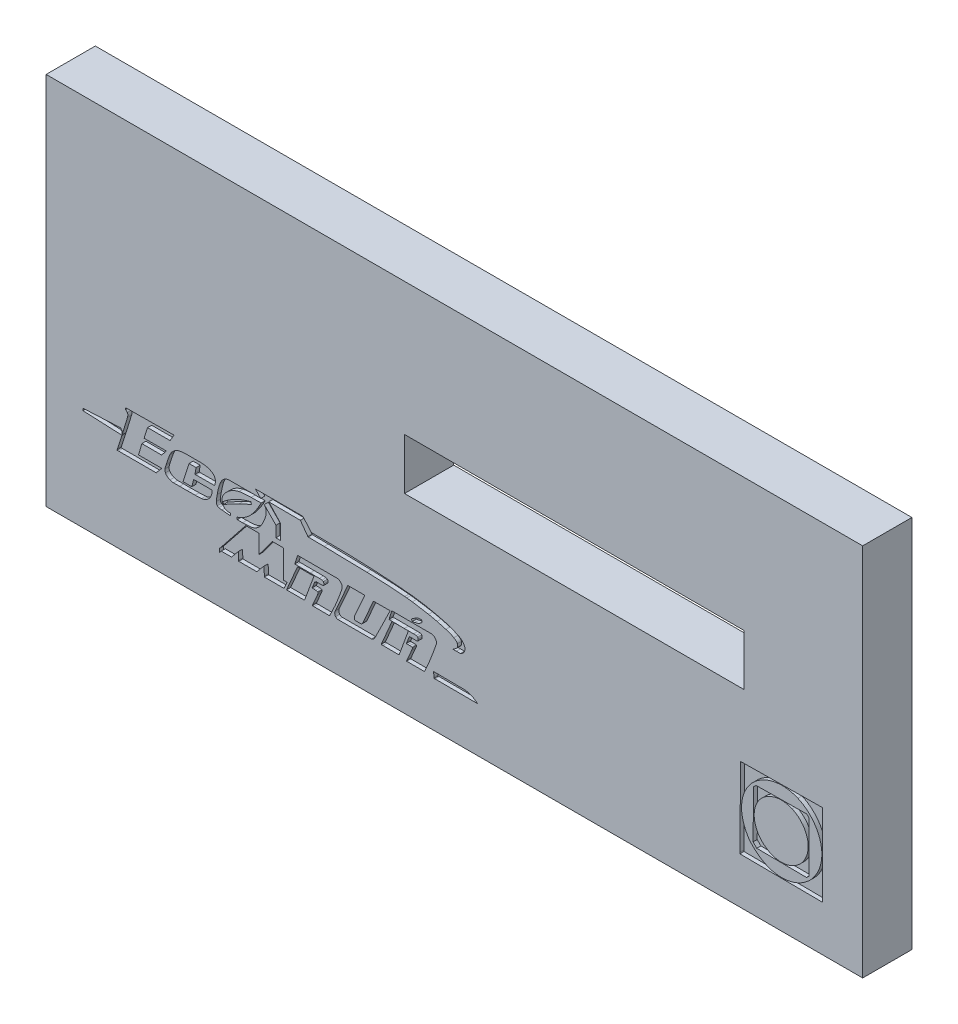
from build123d import *

# Parameters (mm, degrees)
SKETCH2_W                 = 99.573319
SKETCH2_H                 = 45.636873
SKETCH2_W_2               = 41.397503
SKETCH2_H_2               = 6.238481
BOSS_EXTRUDE1_DEPTH       = 5.5
BOSS_EXTRUDE2_START       = 5.5
BOSS_EXTRUDE2_OUTLINE_W   = 99.573319
BOSS_EXTRUDE2_OUTLINE_H   = 45.636873
BOSS_EXTRUDE2_OUTLINE_W_2 = 41.397503
BOSS_EXTRUDE2_OUTLINE_H_2 = 6.238481
BOSS_EXTRUDE2_DEPTH       = 0.5


# Read off the part's stored shape, not the designer's step: Boss-Extrude2
with BuildPart() as part:
    # Sketch2 → Boss-Extrude1 (new body)
    with BuildSketch(Plane.XY):
        with Locations((49.7865755, 22.8181985)):
            Rectangle(SKETCH2_W, SKETCH2_H)
        with Locations((64.4038695, 26.3477085)):
            Rectangle(SKETCH2_W_2, SKETCH2_H_2, mode=Mode.SUBTRACT)
    extrude(amount=BOSS_EXTRUDE1_DEPTH)

    # Boss-Extrude2 outline → Boss-Extrude2 (add)
    # profile 1 of 3: a face of its own
    with BuildSketch(Plane.XY.offset(BOSS_EXTRUDE2_START)):
        with Locations((49.7865755, 22.8181985)):
            Rectangle(BOSS_EXTRUDE2_OUTLINE_W, BOSS_EXTRUDE2_OUTLINE_H)
        with BuildLine():
            add(Edge.make_bspline(
                [(29.056566, 5.943609), (29.137435, 6.133474), (29.218372, 6.323207), (29.29924, 6.513082)],
                knots=[0, 0, 0, 0, 1, 1, 1, 1], degree=3))
            Line((29.056566, 5.943609), (29.0223, 5.863055))
            Line((29.0223, 5.863055), (26.611199, 5.863055))
            Line((26.611199, 5.863055), (26.607588, 5.991577))
            add(Edge.make_bspline(
                [(26.580134, 7.002207), (26.589317, 6.665337), (26.598405, 6.328446), (26.607588, 5.991577)],
                knots=[0, 0, 0, 0, 1, 1, 1, 1], degree=3))
            Line((26.580134, 7.002207), (25.720659, 6.009364))
            Line((25.720659, 6.009364), (25.680981, 5.963596))
            Line((25.680981, 5.963596), (23.486703, 5.963596))
            Line((23.486703, 5.963596), (23.483697, 6.092721))
            Line((23.483697, 6.092721), (23.462656, 6.994009))
            add(Edge.make_bspline(
                [(22.642657, 6.021757), (22.915987, 6.345814), (23.189326, 6.669963), (23.462656, 6.994009)],
                knots=[0, 0, 0, 0, 1, 1, 1, 1], degree=3))
            Line((22.642657, 6.021757), (22.60298, 5.974987))
            Line((22.60298, 5.974987), (21.347532, 5.9712))
            Line((21.347532, 5.9712), (21.150949, 5.724535))
            Line((21.150949, 5.724535), (21.150949, 6.235049))
            Line((21.150949, 6.235049), (21.219683, 6.235049))
            add(Edge.make_bspline(
                [(24.31111, 10.116657), (23.280587, 8.822856), (22.250207, 7.52885), (21.219683, 6.235049)],
                knots=[0, 0, 0, 0, 1, 1, 1, 1], degree=3))
            Line((24.31111, 10.116657), (24.350987, 10.166427))
            Line((24.350987, 10.166427), (25.961132, 10.166621))
            Line((25.961132, 10.166621), (25.961132, 7.920688))
            Line((25.961132, 7.920688), (27.572473, 10.107058))
            Line((27.572473, 10.107058), (28.952563, 10.107058))
            Line((28.952563, 10.107058), (28.922706, 6.696981))
            Line((28.922706, 6.696981), (29.377392, 6.696981))
            Line((29.377392, 6.696981), (29.29924, 6.513082))
        make_face(mode=Mode.SUBTRACT)
        Polygon((29.315466, 5.862861), (30.66149, 8.975305), (32.662991, 8.975305), (31.51275, 5.862861), align=None, mode=Mode.SUBTRACT)
        with BuildLine():
            add(Edge.make_bspline(
                [(35.507587, 10.171114), (33.925096, 10.174798), (32.342634, 10.178585), (30.760132, 10.1823)],
                knots=[0, 0, 0, 0, 1, 1, 1, 1], degree=3))
            Line((35.507587, 10.171114), (35.521013, 10.171114))
            Line((35.521013, 10.171114), (35.53424, 10.168351))
            add(Edge.make_bspline(
                [(36.06808, 9.738994), (35.938469, 10.08574), (35.57724, 10.159447), (35.53424, 10.168351)],
                knots=[0, 0, 0, 0, 1, 1, 1, 1], degree=3))
            add(Edge.make_bspline(
                [(36.096936, 9.401981), (36.10968, 9.474859), (36.119989, 9.600126), (36.06808, 9.738994)],
                knots=[0, 0, 0, 0, 1, 1, 1, 1], degree=3))
            Line((36.096936, 9.401981), (36.095335, 9.39277))
            Line((36.095335, 9.39277), (36.092329, 9.383559))
            add(Edge.make_bspline(
                [(35.765893, 8.451691), (35.88377, 8.767673), (35.992298, 9.078436), (36.092329, 9.383559)],
                knots=[0, 0, 0, 0, 1, 1, 1, 1], degree=3))
            add(Edge.make_bspline(
                [(34.606233, 5.82397), (35.01274, 6.616601), (35.408095, 7.49259), (35.765893, 8.451691)],
                knots=[0, 0, 0, 0, 1, 1, 1, 1], degree=3))
            Line((34.606233, 5.82397), (34.56916, 5.751614))
            Line((34.56916, 5.751614), (34.487601, 5.751614))
            add(Edge.make_bspline(
                [(32.651221, 5.7628), (33.263302, 5.759116), (33.875494, 5.75533), (34.487601, 5.751614)],
                knots=[0, 0, 0, 0, 1, 1, 1, 1], degree=3))
            Line((32.651221, 5.7628), (32.452234, 5.764029))
            Line((32.452234, 5.764029), (32.530185, 5.94672))
            add(Edge.make_bspline(
                [(33.069236, 7.178829), (32.918023, 6.850822), (32.743344, 6.446478), (32.530185, 5.94672)],
                knots=[0, 0, 0, 0, 1, 1, 1, 1], degree=3))
            add(Edge.make_bspline(
                [(33.151596, 7.395908), (33.130625, 7.313307), (33.090701, 7.225395), (33.069236, 7.178829)],
                knots=[0, 0, 0, 0, 1, 1, 1, 1], degree=3))
            add(Edge.make_bspline(
                [(33.157403, 7.538624), (33.160184, 7.535349), (33.172535, 7.478385), (33.151596, 7.395908)],
                knots=[0, 0, 0, 0, 1, 1, 1, 1], degree=3))
            add(Edge.make_bspline(
                [(33.08847, 7.576603), (33.114634, 7.565786), (33.155706, 7.540538), (33.157403, 7.538624)],
                knots=[0, 0, 0, 0, 1, 1, 1, 1], degree=3))
            add(Edge.make_bspline(
                [(32.872849, 7.599999), (33.001331, 7.596928), (33.045639, 7.59437), (33.08847, 7.576603)],
                knots=[0, 0, 0, 0, 1, 1, 1, 1], degree=3))
            add(Edge.make_bspline(
                [(32.625567, 7.605627), (32.66193, 7.604502), (32.748692, 7.603069), (32.872849, 7.599999)],
                knots=[0, 0, 0, 0, 1, 1, 1, 1], degree=3))
            Line((32.625567, 7.605627), (32.436398, 7.611461))
            Line((32.436398, 7.611461), (32.506736, 7.786763))
            add(Edge.make_bspline(
                [(32.775459, 8.456982), (32.685883, 8.23361), (32.596311, 8.010135), (32.506736, 7.786763)],
                knots=[0, 0, 0, 0, 1, 1, 1, 1], degree=3))
            Line((32.775459, 8.456982), (33.030957, 8.407807))
            Line((33.030957, 8.407807), (32.900102, 8.539941))
            add(Edge.make_bspline(
                [(33.461997, 8.528745), (33.339701, 8.532122), (33.146315, 8.53683), (32.900102, 8.539941)],
                knots=[0, 0, 0, 0, 1, 1, 1, 1], degree=3))
            add(Edge.make_bspline(
                [(33.741142, 8.527721), (33.688384, 8.522297), (33.596985, 8.524549), (33.461997, 8.528745)],
                knots=[0, 0, 0, 0, 1, 1, 1, 1], degree=3))
            add(Edge.make_bspline(
                [(33.816087, 8.553911), (33.798555, 8.53685), (33.793899, 8.533166), (33.741142, 8.527721)],
                knots=[0, 0, 0, 0, 1, 1, 1, 1], degree=3))
            add(Edge.make_bspline(
                [(33.867789, 8.761389), (33.868927, 8.703464), (33.858729, 8.59539), (33.816087, 8.553911)],
                knots=[0, 0, 0, 0, 1, 1, 1, 1], degree=3))
            add(Edge.make_bspline(
                [(33.807271, 8.967875), (33.854947, 8.905334), (33.867296, 8.786535), (33.867789, 8.761389)],
                knots=[0, 0, 0, 0, 1, 1, 1, 1], degree=3))
            add(Edge.make_bspline(
                [(33.634133, 9.058622), (33.72003, 9.041255), (33.771912, 9.014267), (33.807271, 8.967875)],
                knots=[0, 0, 0, 0, 1, 1, 1, 1], degree=3))
            add(Edge.make_bspline(
                [(33.311905, 9.079408), (33.435074, 9.078384), (33.548237, 9.076031), (33.634133, 9.058622)],
                knots=[0, 0, 0, 0, 1, 1, 1, 1], degree=3))
            add(Edge.make_bspline(
                [(32.194126, 9.079408), (32.462875, 9.081455), (32.831107, 9.08258), (33.311905, 9.079408)],
                knots=[0, 0, 0, 0, 1, 1, 1, 1], degree=3))
            Line((32.194126, 9.079408), (32.192074, 9.079408))
            add(Edge.make_bspline(
                [(30.501377, 9.090604), (31.064941, 9.08692), (31.62848, 9.083133), (32.192074, 9.079408)],
                knots=[0, 0, 0, 0, 1, 1, 1, 1], degree=3))
            Line((30.501377, 9.090604), (30.32283, 9.091832))
            Line((30.32283, 9.091832), (30.375732, 9.261946))
            add(Edge.make_bspline(
                [(30.633235, 10.088472), (30.54739, 9.812977), (30.461577, 9.537431), (30.375732, 9.261946)],
                knots=[0, 0, 0, 0, 1, 1, 1, 1], degree=3))
            Line((30.633235, 10.088472), (30.662291, 10.181624))
            Line((30.662291, 10.181624), (30.760132, 10.1823))
        make_face(mode=Mode.SUBTRACT)
        with BuildLine():
            add(Edge.make_bspline(
                [(37.643472, 7.314781), (37.746048, 7.541356), (38.186357, 8.526166), (38.793114, 9.876532)],
                knots=[0, 0, 0, 0, 1, 1, 1, 1], degree=3))
            add(Edge.make_bspline(
                [(37.600388, 7.165862), (37.613792, 7.249067), (37.638686, 7.304188), (37.643472, 7.314781)],
                knots=[0, 0, 0, 0, 1, 1, 1, 1], degree=3))
            add(Edge.make_bspline(
                [(37.591175, 6.998154), (37.586127, 7.074174), (37.597208, 7.14611), (37.600388, 7.165862)],
                knots=[0, 0, 0, 0, 1, 1, 1, 1], degree=3))
            add(Edge.make_bspline(
                [(37.648888, 6.836249), (37.620467, 6.858539), (37.596218, 6.922134), (37.591175, 6.998154)],
                knots=[0, 0, 0, 0, 1, 1, 1, 1], degree=3))
            add(Edge.make_bspline(
                [(37.677343, 6.824848), (37.657472, 6.828634), (37.658282, 6.828839), (37.648888, 6.836249)],
                knots=[0, 0, 0, 0, 1, 1, 1, 1], degree=3))
            add(Edge.make_bspline(
                [(37.796174, 6.816251), (37.736334, 6.818298), (37.697213, 6.821061), (37.677343, 6.824848)],
                knots=[0, 0, 0, 0, 1, 1, 1, 1], degree=3))
            add(Edge.make_bspline(
                [(38.299956, 6.811645), (38.183845, 6.803663), (38.01837, 6.808473), (37.796174, 6.816251)],
                knots=[0, 0, 0, 0, 1, 1, 1, 1], degree=3))
            add(Edge.make_bspline(
                [(38.507561, 6.865222), (38.474985, 6.840189), (38.416068, 6.819669), (38.299956, 6.811645)],
                knots=[0, 0, 0, 0, 1, 1, 1, 1], degree=3))
            add(Edge.make_bspline(
                [(38.644628, 7.055517), (38.599795, 6.944496), (38.544492, 6.893611), (38.507561, 6.865222)],
                knots=[0, 0, 0, 0, 1, 1, 1, 1], degree=3))
            Line((38.644628, 7.055517), (38.645243, 7.057154))
            Line((38.645243, 7.057154), (38.645859, 7.058587))
            add(Edge.make_bspline(
                [(39.87205, 9.886203), (39.463363, 8.943681), (39.054547, 8.001109), (38.645859, 7.058587)],
                knots=[0, 0, 0, 0, 1, 1, 1, 1], degree=3))
            Line((39.87205, 9.886203), (39.906317, 9.965549))
            Line((39.906317, 9.965549), (39.993086, 9.965549))
            add(Edge.make_bspline(
                [(41.739691, 9.972918), (41.157467, 9.970359), (40.575324, 9.968005), (39.993086, 9.965549)],
                knots=[0, 0, 0, 0, 1, 1, 1, 1], degree=3))
            Line((41.739691, 9.972918), (41.951905, 9.973941))
            Line((41.951905, 9.973941), (41.859525, 9.783451))
            add(Edge.make_bspline(
                [(40.624317, 7.252076), (40.939694, 7.891654), (41.367961, 8.768922), (41.859525, 9.783451)],
                knots=[0, 0, 0, 0, 1, 1, 1, 1], degree=3))
            add(Edge.make_bspline(
                [(40.241971, 6.483311), (40.337119, 6.671969), (40.466628, 6.932287), (40.624317, 7.252076)],
                knots=[0, 0, 0, 0, 1, 1, 1, 1], degree=3))
            add(Edge.make_bspline(
                [(40.061219, 6.137302), (40.094078, 6.189732), (40.146822, 6.294653), (40.241971, 6.483311)],
                knots=[0, 0, 0, 0, 1, 1, 1, 1], degree=3))
            add(Edge.make_bspline(
                [(39.944792, 5.99958), (39.979413, 6.030917), (40.023001, 6.076316), (40.061219, 6.137302)],
                knots=[0, 0, 0, 0, 1, 1, 1, 1], degree=3))
            add(Edge.make_bspline(
                [(39.900907, 5.963197), (39.912243, 5.971794), (39.927481, 5.983911), (39.944792, 5.99958)],
                knots=[0, 0, 0, 0, 1, 1, 1, 1], degree=3))
            add(Edge.make_bspline(
                [(39.896095, 5.959615), (39.897839, 5.960945), (39.898926, 5.961662), (39.900907, 5.963197)],
                knots=[0, 0, 0, 0, 1, 1, 1, 1], degree=3))
            Line((39.896095, 5.959615), (39.894094, 5.957363))
            Line((39.894094, 5.957363), (39.879866, 5.947948))
            add(Edge.make_bspline(
                [(39.687691, 5.866391), (39.733852, 5.877107), (39.805235, 5.898813), (39.879866, 5.947948)],
                knots=[0, 0, 0, 0, 1, 1, 1, 1], degree=3))
            Line((39.687691, 5.866391), (39.672863, 5.862809))
            Line((39.672863, 5.862809), (35.615753, 5.862809))
            Line((35.615753, 5.862809), (35.604932, 5.864856))
            add(Edge.make_bspline(
                [(35.300739, 6.033762), (35.409041, 5.902928), (35.552963, 5.873525), (35.604932, 5.864856)],
                knots=[0, 0, 0, 0, 1, 1, 1, 1], degree=3))
            add(Edge.make_bspline(
                [(35.269458728, 6.639036843), (35.158393152, 6.441212365), (35.162788159, 6.200402967), (35.300739, 6.033762)],
                knots=[0.010651187, 0.010651187, 0.010651187, 0.010651187, 1, 1, 1, 1], degree=3))
            Line((35.269458728, 6.639036843), (36.794646, 10.062293))
            Line((36.794646, 10.062293), (38.804736, 10.062631))
            Line((38.804736, 10.062631), (38.804736, 9.902322))
            Line((38.804736, 9.902322), (38.793114, 9.876532))
        make_face(mode=Mode.SUBTRACT)
        with BuildLine():
            add(Edge.make_bspline(
                [(42.148484, 8.880158), (41.744734, 7.937298), (41.340872, 6.994408), (40.937122, 6.051549)],
                knots=[0, 0, 0, 0, 1, 1, 1, 1], degree=3))
            Line((42.148484, 8.880158), (42.18275, 8.960312))
            Line((42.18275, 8.960312), (43.987068, 8.960046))
            Line((43.987068, 8.960046), (44.176237, 8.960046))
            Line((44.176237, 8.960046), (44.111511, 8.782748))
            Line((44.111511, 8.782748), (43.073287, 5.93755))
            Line((43.073287, 5.93755), (43.041224, 5.849802))
            Line((43.041224, 5.849802), (42.947642, 5.850825))
            Line((42.947642, 5.850825), (41.057758, 5.867415))
            Line((41.057758, 5.867415), (40.85917, 5.869257))
            Line((40.85917, 5.869257), (40.937122, 6.051549))
        make_face(mode=Mode.SUBTRACT)
        with BuildLine():
            add(Edge.make_bspline(
                [(46.998385, 10.056644), (45.415894, 10.060328), (43.833231, 10.064115), (42.250729, 10.06784)],
                knots=[0, 0, 0, 0, 1, 1, 1, 1], degree=3))
            Line((46.998385, 10.056644), (47.011811, 10.056644))
            Line((47.011811, 10.056644), (47.024836, 10.053881))
            add(Edge.make_bspline(
                [(47.558878, 9.624524), (47.429265, 9.97127), (47.067837, 10.044977), (47.024836, 10.053881)],
                knots=[0, 0, 0, 0, 1, 1, 1, 1], degree=3))
            add(Edge.make_bspline(
                [(47.587533, 9.287511), (47.60028, 9.360378), (47.610786, 9.485656), (47.558878, 9.624524)],
                knots=[0, 0, 0, 0, 1, 1, 1, 1], degree=3))
            Line((47.587533, 9.287511), (47.585932, 9.277686))
            Line((47.585932, 9.277686), (47.582731, 9.26827))
            add(Edge.make_bspline(
                [(47.256896, 8.337989), (47.371616, 8.651781), (47.480067, 8.961898), (47.582731, 9.26827)],
                knots=[0, 0, 0, 0, 1, 1, 1, 1], degree=3))
            add(Edge.make_bspline(
                [(46.182802, 5.721065), (46.556009, 6.538371), (46.917933, 7.41086), (47.256896, 8.337989)],
                knots=[0, 0, 0, 0, 1, 1, 1, 1], degree=3))
            Line((46.182802, 5.721065), (46.147332, 5.64351))
            Line((46.147332, 5.64351), (43.942634, 5.649344))
            Line((43.942634, 5.649344), (44.020988, 5.832639))
            add(Edge.make_bspline(
                [(44.559838, 7.064544), (44.408639, 6.736567), (44.234117, 6.332335), (44.020988, 5.832639)],
                knots=[0, 0, 0, 0, 1, 1, 1, 1], degree=3))
            add(Edge.make_bspline(
                [(44.642198, 7.281816), (44.621227, 7.199226), (44.581303, 7.111109), (44.559838, 7.064544)],
                knots=[0, 0, 0, 0, 1, 1, 1, 1], degree=3))
            add(Edge.make_bspline(
                [(44.64821, 7.424543), (44.65097, 7.421473), (44.663171, 7.364417), (44.642198, 7.281816)],
                knots=[0, 0, 0, 0, 1, 1, 1, 1], degree=3))
            add(Edge.make_bspline(
                [(44.579276, 7.462522), (44.605349, 7.451745), (44.646503, 7.426467), (44.64821, 7.424543)],
                knots=[0, 0, 0, 0, 1, 1, 1, 1], degree=3))
            Line((44.579276, 7.462522), (44.57907, 7.462522))
            add(Edge.make_bspline(
                [(44.36365, 7.486102), (44.492132, 7.483032), (44.53624, 7.480268), (44.57907, 7.462522)],
                knots=[0, 0, 0, 0, 1, 1, 1, 1], degree=3))
            Line((44.36365, 7.486102), (44.363445, 7.486102))
            add(Edge.make_bspline(
                [(44.116363, 7.491731), (44.152726, 7.490605), (44.239288, 7.489172), (44.363445, 7.486102)],
                knots=[0, 0, 0, 0, 1, 1, 1, 1], degree=3))
            Line((44.116363, 7.491731), (43.927194, 7.497564))
            Line((43.927194, 7.497564), (43.997331, 7.672856))
            add(Edge.make_bspline(
                [(44.266055, 8.343086), (44.17648, 8.119703), (44.086907, 7.896228), (43.997331, 7.672856)],
                knots=[0, 0, 0, 0, 1, 1, 1, 1], degree=3))
            Line((44.266055, 8.343086), (44.299921, 8.427231))
            Line((44.299921, 8.427231), (44.390698, 8.426003))
            add(Edge.make_bspline(
                [(44.952593, 8.414807), (44.830297, 8.418184), (44.636911, 8.422892), (44.390698, 8.426003)],
                knots=[0, 0, 0, 0, 1, 1, 1, 1], degree=3))
            add(Edge.make_bspline(
                [(45.231738, 8.413784), (45.178978, 8.40836), (45.087582, 8.410611), (44.952593, 8.414807)],
                knots=[0, 0, 0, 0, 1, 1, 1, 1], degree=3))
            add(Edge.make_bspline(
                [(45.306684, 8.439963), (45.289153, 8.422913), (45.284498, 8.419218), (45.231738, 8.413784)],
                knots=[0, 0, 0, 0, 1, 1, 1, 1], degree=3))
            add(Edge.make_bspline(
                [(45.358384, 8.647452), (45.359523, 8.589526), (45.349335, 8.481463), (45.306684, 8.439963)],
                knots=[0, 0, 0, 0, 1, 1, 1, 1], degree=3))
            add(Edge.make_bspline(
                [(45.297867, 8.853938), (45.345543, 8.791386), (45.357892, 8.672587), (45.358384, 8.647452)],
                knots=[0, 0, 0, 0, 1, 1, 1, 1], degree=3))
            add(Edge.make_bspline(
                [(45.124929, 8.94449), (45.210826, 8.927123), (45.262508, 8.900329), (45.297867, 8.853938)],
                knots=[0, 0, 0, 0, 1, 1, 1, 1], degree=3))
            add(Edge.make_bspline(
                [(44.8025, 8.965276), (44.92567, 8.964252), (45.039032, 8.961898), (45.124929, 8.94449)],
                knots=[0, 0, 0, 0, 1, 1, 1, 1], degree=3))
            add(Edge.make_bspline(
                [(43.684721, 8.965276), (43.953471, 8.967323), (44.321703, 8.968448), (44.8025, 8.965276)],
                knots=[0, 0, 0, 0, 1, 1, 1, 1], degree=3))
            Line((43.684721, 8.965276), (43.682875, 8.965276))
            add(Edge.make_bspline(
                [(41.991978, 8.976472), (42.555542, 8.972788), (43.119281, 8.969001), (43.682875, 8.965276)],
                knots=[0, 0, 0, 0, 1, 1, 1, 1], degree=3))
            Line((41.991978, 8.976472), (41.81343, 8.9777))
            Line((41.81343, 8.9777), (41.866534, 9.147803))
            add(Edge.make_bspline(
                [(42.124036, 9.97434), (42.03819, 9.698845), (41.952379, 9.423299), (41.866534, 9.147803)],
                knots=[0, 0, 0, 0, 1, 1, 1, 1], degree=3))
            Line((42.124036, 9.97434), (42.153093, 10.067482))
            Line((42.153093, 10.067482), (42.250729, 10.06784))
        make_face(mode=Mode.SUBTRACT)
        with BuildLine():
            add(Edge.make_bspline(
                [(45.724455, 10.926574), (45.692008, 10.935683), (45.666307, 10.936819), (45.641694, 10.936962)],
                knots=[0, 0, 0, 0, 1, 1, 1, 1], degree=3))
            add(Edge.make_bspline(
                [(45.836874, 10.833228), (45.809956, 10.895523), (45.756902, 10.917445), (45.724455, 10.926574)],
                knots=[0, 0, 0, 0, 1, 1, 1, 1], degree=3))
            add(Edge.make_bspline(
                [(45.809421, 10.656728), (45.833495, 10.690829), (45.873356, 10.748805), (45.836874, 10.833228)],
                knots=[0, 0, 0, 0, 1, 1, 1, 1], degree=3))
            add(Edge.make_bspline(
                [(45.727661, 10.569972), (45.758084, 10.596418), (45.785346, 10.622617), (45.809421, 10.656728)],
                knots=[0, 0, 0, 0, 1, 1, 1, 1], degree=3))
            add(Edge.make_bspline(
                [(45.526269, 10.428454), (45.593479, 10.467323), (45.666816, 10.517082), (45.727661, 10.569972)],
                knots=[0, 0, 0, 0, 1, 1, 1, 1], degree=3))
            add(Edge.make_bspline(
                [(44.959965, 10.238557), (45.179376, 10.286965), (45.347047, 10.324822), (45.526269, 10.428454)],
                knots=[0, 0, 0, 0, 1, 1, 1, 1], degree=3))
            add(Edge.make_bspline(
                [(44.648557, 10.18099), (44.722151, 10.191951), (44.830318, 10.209973), (44.959965, 10.238557)],
                knots=[0, 0, 0, 0, 1, 1, 1, 1], degree=3))
            Line((44.648557, 10.18099), (44.550166, 10.417861))
            add(Edge.make_bspline(
                [(45.093826, 10.777451), (44.948173, 10.692159), (44.761798, 10.574363), (44.550166, 10.417861)],
                knots=[0, 0, 0, 0, 1, 1, 1, 1], degree=3))
            add(Edge.make_bspline(
                [(45.519455, 10.927168), (45.305325, 10.899955), (45.150188, 10.810477), (45.093826, 10.777451)],
                knots=[0, 0, 0, 0, 1, 1, 1, 1], degree=3))
            add(Edge.make_bspline(
                [(45.641694, 10.936962), (45.592465, 10.936993), (45.547581, 10.93075), (45.519455, 10.927168)],
                knots=[0, 0, 0, 0, 1, 1, 1, 1], degree=3))
        make_face(mode=Mode.SUBTRACT)
        with BuildLine():
            add(Edge.make_bspline(
                [(8.987837, 12.848471), (7.488728, 12.777261), (5.989578, 12.70599), (4.49047, 12.63479)],
                knots=[0, 0, 0, 0, 1, 1, 1, 1], degree=3))
            Line((8.987837, 12.848471), (8.987837, 12.854713))
            Line((8.987837, 12.854713), (9.12191, 12.854662))
            Line((9.12191, 12.854662), (9.128117, 12.596811))
            Line((9.128117, 12.596811), (9.254363, 12.724135))
            Line((9.254363, 12.724135), (9.260904852, 12.205106417))
            add(Edge.make_bspline(
                [(9.925265, 14.387453), (9.856025856, 14.122458411), (9.617888354, 13.33082503), (9.260904852, 12.205106417)],
                knots=[0, 0, 0, 0, 0.684167748, 0.684167748, 0.684167748, 0.684167748], degree=3))
            add(Edge.make_bspline(
                [(9.905827, 14.882974), (9.999551, 14.718828), (9.957104, 14.509302), (9.925265, 14.387453)],
                knots=[0, 0, 0, 0, 1, 1, 1, 1], degree=3))
            add(Edge.make_bspline(
                [(9.744914, 15.045883), (9.791523, 15.016439), (9.859334, 14.964398), (9.905827, 14.882974)],
                knots=[0, 0, 0, 0, 1, 1, 1, 1], degree=3))
            Line((9.744914, 15.045883), (9.683192, 15.084855))
            Line((9.683192, 15.084855), (9.683192, 15.288547))
            Line((9.683192, 15.288547), (15.589908, 15.341918))
            Line((15.589908, 15.341918), (15.476286, 15.142453))
            add(Edge.make_bspline(
                [(15.162073, 14.59137), (15.26678, 14.775044), (15.37158, 14.958779), (15.476286, 15.142453)],
                knots=[0, 0, 0, 0, 1, 1, 1, 1], degree=3))
            Line((15.162073, 14.59137), (15.124, 14.524602))
            Line((15.124, 14.524602), (12.371033, 14.524602))
            Line((12.371033, 14.524602), (11.947808, 13.189158))
            Line((11.947808, 13.189158), (14.666107, 13.194173))
            Line((14.666107, 13.194173), (14.492168, 12.978701))
            add(Edge.make_bspline(
                [(14.130262, 12.53035), (14.250866, 12.67979), (14.371561, 12.829251), (14.492168, 12.978701)],
                knots=[0, 0, 0, 0, 1, 1, 1, 1], degree=3))
            Line((14.130262, 12.53035), (14.090384, 12.48098))
            Line((14.090384, 12.48098), (14.026861, 12.48098))
            add(Edge.make_bspline(
                [(11.673273, 12.487325), (12.457802, 12.485176), (13.242352, 12.483129), (14.026861, 12.48098)],
                knots=[0, 0, 0, 0, 1, 1, 1, 1], degree=3))
            add(Edge.make_bspline(
                [(11.27169, 11.087712), (11.405576, 11.55426), (11.539387, 12.020787), (11.673273, 12.487325)],
                knots=[0, 0, 0, 0, 1, 1, 1, 1], degree=3))
            add(Edge.make_bspline(
                [(13.823063, 11.085358), (12.972591, 11.086382), (12.122145, 11.086996), (11.27169, 11.087712)],
                knots=[0, 0, 0, 0, 1, 1, 1, 1], degree=3))
            Line((13.823063, 11.085358), (14.106817, 11.085358))
            Line((14.106817, 11.085358), (13.924461, 10.868679))
            add(Edge.make_bspline(
                [(13.465367, 10.32299), (13.618364, 10.504873), (13.771461, 10.686796), (13.924461, 10.868679)],
                knots=[0, 0, 0, 0, 1, 1, 1, 1], degree=3))
            Line((13.465367, 10.32299), (13.425689, 10.27581))
            Line((13.425689, 10.27581), (13.363968, 10.27581))
            add(Edge.make_bspline(
                [(8.821312, 10.278369), (10.335519, 10.277345), (11.849774, 10.276629), (13.363968, 10.27581)],
                knots=[0, 0, 0, 0, 1, 1, 1, 1], degree=3))
            Line((8.821312, 10.278369), (8.638757, 10.278369))
            Line((8.638757, 10.278369), (8.695467, 10.45147))
            add(Edge.make_bspline(
                [(9.244261218, 12.15265137), (9.083352136, 11.645802634), (8.898938897, 11.073041501), (8.695467, 10.45147)],
                knots=[0.694746061, 0.694746061, 0.694746061, 0.694746061, 1, 1, 1, 1], degree=3))
            Line((9.244261218, 12.15265137), (4.490675, 12.370737))
            Line((4.490675, 12.370737), (4.49047, 12.63479))
        make_face(mode=Mode.SUBTRACT)
        with BuildLine():
            add(Edge.make_bspline(
                [(17.945502, 14.077653), (17.367511, 14.073457), (17.444537, 14.088972), (17.169389, 14.079597)],
                knots=[0, 0, 0, 0, 1, 1, 1, 1], degree=3))
            add(Edge.make_bspline(
                [(18.889542, 14.079086), (18.537568, 14.090292), (18.378641, 14.080826), (17.945502, 14.077653)],
                knots=[0, 0, 0, 0, 1, 1, 1, 1], degree=3))
            add(Edge.make_bspline(
                [(19.70894, 13.96655), (19.396265, 14.056222), (19.129445, 14.071461), (18.889542, 14.079086)],
                knots=[0, 0, 0, 0, 1, 1, 1, 1], degree=3))
            add(Edge.make_bspline(
                [(20.027761, 13.844026), (19.95502, 13.881647), (19.858001, 13.923802), (19.70894, 13.96655)],
                knots=[0, 0, 0, 0, 1, 1, 1, 1], degree=3))
            add(Edge.make_bspline(
                [(20.513909, 13.443049), (20.371619, 13.671497), (20.142758, 13.784545), (20.027761, 13.844026)],
                knots=[0, 0, 0, 0, 1, 1, 1, 1], degree=3))
            add(Edge.make_bspline(
                [(20.562805, 12.575739), (20.589883, 12.649138), (20.746679, 13.069325), (20.513909, 13.443049)],
                knots=[0, 0, 0, 0, 1, 1, 1, 1], degree=3))
            Line((20.562805, 12.575739), (20.530943, 12.489587))
            Line((20.530943, 12.489587), (20.438964, 12.489587))
            add(Edge.make_bspline(
                [(18.310613, 12.481399), (19.020108, 12.48406), (19.729495, 12.486926), (20.438964, 12.489587)],
                knots=[0, 0, 0, 0, 1, 1, 1, 1], degree=3))
            Line((18.310613, 12.481399), (18.177555, 12.481399))
            Line((18.177555, 12.481399), (18.177555, 12.625119))
            Line((18.177555, 12.625119), (18.179555, 12.636121))
            add(Edge.make_bspline(
                [(18.285963, 13.260163), (18.250483, 13.052152), (18.215034, 12.844131), (18.179555, 12.636121)],
                knots=[0, 0, 0, 0, 1, 1, 1, 1], degree=3))
            add(Edge.make_bspline(
                [(17.429293, 13.262415), (17.714856, 13.261391), (18.000428, 13.260879), (18.285963, 13.260163)],
                knots=[0, 0, 0, 0, 1, 1, 1, 1], degree=3))
            Line((17.429293, 13.262415), (16.703478, 10.978697))
            add(Edge.make_bspline(
                [(17.763344, 10.974501), (17.410091, 10.975934), (17.056744, 10.977264), (16.703478, 10.978697)],
                knots=[0, 0, 0, 0, 1, 1, 1, 1], degree=3))
            add(Edge.make_bspline(
                [(17.966139, 11.757461), (17.898585, 11.496447), (17.830897, 11.235515), (17.763344, 10.974501)],
                knots=[0, 0, 0, 0, 1, 1, 1, 1], degree=3))
            Line((17.966139, 11.757461), (17.991789, 11.85661))
            Line((17.991789, 11.85661), (20.217528, 11.85661))
            Line((20.217528, 11.85661), (20.219734, 11.726881))
            add(Edge.make_bspline(
                [(20.047598, 11.025877), (20.207145, 11.309222), (20.222332, 11.583233), (20.219734, 11.726881)],
                knots=[0, 0, 0, 0, 1, 1, 1, 1], degree=3))
            add(Edge.make_bspline(
                [(19.2278, 10.375839), (19.383125, 10.432414), (19.802428, 10.590472), (20.047598, 11.025877)],
                knots=[0, 0, 0, 0, 1, 1, 1, 1], degree=3))
            add(Edge.make_bspline(
                [(18.95106, 10.320472), (19.097851, 10.33435), (19.171894, 10.355473), (19.2278, 10.375839)],
                knots=[0, 0, 0, 0, 1, 1, 1, 1], degree=3))
            add(Edge.make_bspline(
                [(18.171741, 10.28849), (18.575024, 10.296166), (18.804269, 10.306595), (18.95106, 10.320472)],
                knots=[0, 0, 0, 0, 1, 1, 1, 1], degree=3))
            add(Edge.make_bspline(
                [(17.205859, 10.280507), (17.693928, 10.283066), (17.866184, 10.282759), (18.171741, 10.28849)],
                knots=[0, 0, 0, 0, 1, 1, 1, 1], degree=3))
            add(Edge.make_bspline(
                [(16.269432, 10.277744), (16.580404, 10.28061), (16.892558, 10.27887), (17.205859, 10.280507)],
                knots=[0, 0, 0, 0, 1, 1, 1, 1], degree=3))
            add(Edge.make_bspline(
                [(15.536403, 10.278768), (15.70402, 10.269659), (15.919303, 10.274981), (16.269432, 10.277744)],
                knots=[0, 0, 0, 0, 1, 1, 1, 1], degree=3))
            add(Edge.make_bspline(
                [(15.110773, 10.37151), (15.244129, 10.31515), (15.368787, 10.287917), (15.536403, 10.278768)],
                knots=[0, 0, 0, 0, 1, 1, 1, 1], degree=3))
            add(Edge.make_bspline(
                [(14.547676, 10.837649), (14.682661, 10.545676), (14.971827, 10.430245), (15.110773, 10.37151)],
                knots=[0, 0, 0, 0, 1, 1, 1, 1], degree=3))
            add(Edge.make_bspline(
                [(14.499783, 11.227634), (14.479236, 11.088336), (14.491873, 10.958351), (14.547676, 10.837649)],
                knots=[0, 0, 0, 0, 1, 1, 1, 1], degree=3))
            add(Edge.make_bspline(
                [(14.635447, 11.732346), (14.568511, 11.521183), (14.520329, 11.366922), (14.499783, 11.227634)],
                knots=[0, 0, 0, 0, 1, 1, 1, 1], degree=3))
            add(Edge.make_bspline(
                [(15.091336, 13.018226), (14.982824, 12.775705), (14.845629, 12.395422), (14.635447, 11.732346)],
                knots=[0, 0, 0, 0, 1, 1, 1, 1], degree=3))
            add(Edge.make_bspline(
                [(15.373686, 13.462177), (15.288065, 13.372811), (15.199848, 13.260746), (15.091336, 13.018226)],
                knots=[0, 0, 0, 0, 1, 1, 1, 1], degree=3))
            add(Edge.make_bspline(
                [(15.904121, 13.870543), (15.638924, 13.736433), (15.472908, 13.565737), (15.373686, 13.462177)],
                knots=[0, 0, 0, 0, 1, 1, 1, 1], degree=3))
            add(Edge.make_bspline(
                [(17.169387, 14.080826), (16.581402, 14.060828), (16.253136, 14.047042), (15.904121, 13.870543)],
                knots=[0, 0, 0, 0, 1, 1, 1, 1], degree=3))
            Line((17.169387, 14.080826), (17.169389, 14.079597))
        make_face(mode=Mode.SUBTRACT)
        with BuildLine():
            add(Edge.make_bspline(
                [(23.539806, 12.063761), (24.05775, 12.31581), (24.56071, 12.540911), (25.044339, 12.741983)],
                knots=[0, 0, 0, 0, 1, 1, 1, 1], degree=3))
            add(Edge.make_bspline(
                [(21.667556, 11.063324), (22.24084, 11.398167), (22.864962, 11.735365), (23.539806, 12.063761)],
                knots=[0, 0, 0, 0, 1, 1, 1, 1], degree=3))
            Line((21.667556, 11.063324), (21.517063, 11.279798))
            add(Edge.make_bspline(
                [(23.347431, 12.425162), (22.568903, 12.06284), (21.960856, 11.640412), (21.517063, 11.279798)],
                knots=[0, 0, 0, 0, 1, 1, 1, 1], degree=3))
            add(Edge.make_bspline(
                [(24.961779, 12.992241), (24.497202, 12.878447), (23.943972, 12.702786), (23.347431, 12.425162)],
                knots=[0, 0, 0, 0, 1, 1, 1, 1], degree=3))
            Line((24.961779, 12.992241), (25.044339, 12.741983))
        make_face(mode=Mode.SUBTRACT)
        with BuildLine():
            add(Edge.make_bspline(
                [(32.309695, 13.434524), (31.99738, 13.814521), (31.684985, 14.194487), (31.372669, 14.574484)],
                knots=[0, 0, 0, 0, 1, 1, 1, 1], degree=3))
            add(Edge.make_bspline(
                [(37.028095, 13.380364), (35.793843, 13.414925), (34.184356, 13.442711), (32.309695, 13.434524)],
                knots=[0, 0, 0, 0, 1, 1, 1, 1], degree=3))
            add(Edge.make_bspline(
                [(42.48834, 13.103518), (40.501289, 13.253357), (38.716767, 13.333051), (37.028095, 13.380364)],
                knots=[0, 0, 0, 0, 1, 1, 1, 1], degree=3))
            add(Edge.make_bspline(
                [(46.325219, 12.657766), (45.384284, 12.83183), (44.442257, 12.956165), (42.48834, 13.103518)],
                knots=[0, 0, 0, 0, 1, 1, 1, 1], degree=3))
            add(Edge.make_bspline(
                [(48.91106, 12.052309), (48.288083, 12.229689), (47.402432, 12.458495), (46.325219, 12.657766)],
                knots=[0, 0, 0, 0, 1, 1, 1, 1], degree=3))
            Line((48.91106, 12.052309), (48.91266, 12.052309))
            add(Edge.make_bspline(
                [(48.976384, 12.03272), (48.934965, 12.046076), (48.913738, 12.052012), (48.91266, 12.052309)],
                knots=[0, 0, 0, 0, 1, 1, 1, 1], degree=3))
            add(Edge.make_bspline(
                [(49.172366, 11.964561), (49.082954, 11.997361), (49.018829, 12.019037), (48.976384, 12.03272)],
                knots=[0, 0, 0, 0, 1, 1, 1, 1], degree=3))
            add(Edge.make_bspline(
                [(50.038054, 11.610558), (49.630747, 11.789023), (49.351193, 11.898949), (49.172366, 11.964561)],
                knots=[0, 0, 0, 0, 1, 1, 1, 1], degree=3))
            add(Edge.make_bspline(
                [(50.875687, 11.020084), (50.649396, 11.33013), (50.351063, 11.47341), (50.038054, 11.610558)],
                knots=[0, 0, 0, 0, 1, 1, 1, 1], degree=3))
            add(Edge.make_bspline(
                [(51.080286, 10.493983), (51.083251, 10.735071), (50.955926, 10.910158), (50.875687, 11.020084)],
                knots=[0, 0, 0, 0, 1, 1, 1, 1], degree=3))
            add(Edge.make_bspline(
                [(50.838815, 9.957884), (50.956072, 10.079763), (51.07743, 10.261155), (51.080286, 10.493983)],
                knots=[0, 0, 0, 0, 1, 1, 1, 1], degree=3))
            add(Edge.make_bspline(
                [(50.576904, 9.751807), (50.602892, 9.766647), (50.721559, 9.836014), (50.838815, 9.957884)],
                knots=[0, 0, 0, 0, 1, 1, 1, 1], degree=3))
            Line((50.576904, 9.751807), (50.546445, 9.734409))
            Line((50.546445, 9.734409), (50.511177, 9.734409))
            add(Edge.make_bspline(
                [(50.025229, 9.735432), (50.186659, 9.735432), (50.348628, 9.734409), (50.511177, 9.734409)],
                knots=[0, 0, 0, 0, 1, 1, 1, 1], degree=3))
            Line((50.025229, 9.735432), (49.6002, 9.735432))
            Line((49.6002, 9.735432), (49.949882, 9.976295))
            add(Edge.make_bspline(
                [(50.115004, 10.157001), (50.063788, 10.063439), (49.993216, 10.006148), (49.949882, 9.976295)],
                knots=[0, 0, 0, 0, 1, 1, 1, 1], degree=3))
            add(Edge.make_bspline(
                [(50.149872, 10.589356), (50.183497, 10.485346), (50.199689, 10.311691), (50.115004, 10.157001)],
                knots=[0, 0, 0, 0, 1, 1, 1, 1], degree=3))
            add(Edge.make_bspline(
                [(49.714223, 11.00852), (50.069654, 10.791933), (50.120499, 10.680195), (50.149872, 10.589356)],
                knots=[0, 0, 0, 0, 1, 1, 1, 1], degree=3))
            add(Edge.make_bspline(
                [(48.747138, 11.408494), (49.229967, 11.257498), (49.462444, 11.161931), (49.714223, 11.00852)],
                knots=[0, 0, 0, 0, 1, 1, 1, 1], degree=3))
            add(Edge.make_bspline(
                [(47.668835, 11.707722), (47.979304, 11.631129), (48.333536, 11.537844), (48.747138, 11.408494)],
                knots=[0, 0, 0, 0, 1, 1, 1, 1], degree=3))
            add(Edge.make_bspline(
                [(46.633216, 11.940991), (47.111316, 11.844503), (47.561377, 11.734229), (47.668835, 11.707722)],
                knots=[0, 0, 0, 0, 1, 1, 1, 1], degree=3))
            add(Edge.make_bspline(
                [(44.651954, 12.265212), (45.199719, 12.192518), (45.925259, 12.083871), (46.633216, 11.940991)],
                knots=[0, 0, 0, 0, 1, 1, 1, 1], degree=3))
            add(Edge.make_bspline(
                [(43.987659, 12.347362), (44.148568, 12.329073), (44.378071, 12.301553), (44.651954, 12.265212)],
                knots=[0, 0, 0, 0, 1, 1, 1, 1], degree=3))
            add(Edge.make_bspline(
                [(43.748192, 12.37395), (43.82675, 12.365661), (43.987659, 12.347362)],
                knots=[0, 0, 0, 1, 1, 1], degree=2))
            Line((43.748192, 12.37395), (43.741584, 12.37395))
            Line((43.741584, 12.37395), (43.734977, 12.374974))
            add(Edge.make_bspline(
                [(39.115971, 12.627432), (42.019777, 12.535354), (43.200391, 12.428202), (43.734977, 12.374974)],
                knots=[0, 0, 0, 0, 1, 1, 1, 1], degree=3))
            add(Edge.make_bspline(
                [(33.899402, 12.736365), (36.424179, 12.694067), (37.685775, 12.672769), (39.115971, 12.627432)],
                knots=[0, 0, 0, 0, 1, 1, 1, 1], degree=3))
            add(Edge.make_bspline(
                [(32.003706, 12.766146), (32.454496, 12.759597), (33.109481, 12.749608), (33.899402, 12.736365)],
                knots=[0, 0, 0, 0, 1, 1, 1, 1], degree=3))
            Line((32.003706, 12.766146), (31.937377, 12.76717))
            Line((31.937377, 12.76717), (31.898301, 12.82093))
            add(Edge.make_bspline(
                [(31.00536, 14.050246), (31.303021, 13.640447), (31.600641, 13.23074), (31.898301, 12.82093)],
                knots=[0, 0, 0, 0, 1, 1, 1, 1], degree=3))
            add(Edge.make_bspline(
                [(27.146838, 14.073631), (28.433038, 14.065853), (29.719155, 14.057993), (31.00536, 14.050246)],
                knots=[0, 0, 0, 0, 1, 1, 1, 1], degree=3))
            Line((27.146838, 14.073631), (28.570013, 12.543491))
            Line((28.570013, 12.543491), (28.570013, 10.707326))
            Line((28.570013, 10.707326), (28.02515, 10.707326))
            Line((28.02515, 10.707326), (28.02515, 12.040376))
            Line((28.02515, 12.040376), (26.599729875, 13.507863014))
            add(Edge.make_bspline(
                [(26.688945, 13.378993), (26.660265812, 13.427969866), (26.629703868, 13.470829971), (26.599729875, 13.507863014)],
                knots=[0, 0, 0, 0, 0.410959046, 0.410959046, 0.410959046, 0.410959046], degree=3))
            add(Edge.make_bspline(
                [(26.570715, 11.795481), (26.714199, 12.12928), (27.02259, 12.809233), (26.688945, 13.378993)],
                knots=[0, 0, 0, 0, 1, 1, 1, 1], degree=3))
            add(Edge.make_bspline(
                [(25.583791, 10.536988), (26.172404, 10.862487), (26.411774, 11.425738), (26.570715, 11.795481)],
                knots=[0, 0, 0, 0, 1, 1, 1, 1], degree=3))
            add(Edge.make_bspline(
                [(23.955817, 10.263549), (24.699686, 10.284765), (25.147057, 10.29549), (25.583791, 10.536988)],
                knots=[0, 0, 0, 0, 1, 1, 1, 1], degree=3))
            add(Edge.make_bspline(
                [(23.309958, 10.273374), (23.463443, 10.264163), (23.686689, 10.255853), (23.955817, 10.263549)],
                knots=[0, 0, 0, 0, 1, 1, 1, 1], degree=3))
            Line((23.309958, 10.273374), (23.278096, 10.53142))
            add(Edge.make_bspline(
                [(24.25961, 10.99716), (23.873571, 10.742143), (23.514184, 10.605588), (23.278096, 10.53142)],
                knots=[0, 0, 0, 0, 1, 1, 1, 1], degree=3))
            add(Edge.make_bspline(
                [(25.678375, 12.546489), (25.314669, 12.004617), (24.938607, 11.445716), (24.25961, 10.99716)],
                knots=[0, 0, 0, 0, 1, 1, 1, 1], degree=3))
            add(Edge.make_bspline(
                [(26.220911689, 13.484406008), (26.100982577, 13.240900142), (25.925477537, 12.914626799), (25.678375, 12.546489)],
                knots=[0.104145914, 0.104145914, 0.104145914, 0.104145914, 1, 1, 1, 1], degree=3))
            add(Edge.make_bspline(
                [(24.99885, 13.469402), (25.494599959, 13.486856301), (25.913114251, 13.487698392), (26.220911689, 13.484406008)],
                knots=[0, 0, 0, 0, 0.92995372, 0.92995372, 0.92995372, 0.92995372], degree=3))
            add(Edge.make_bspline(
                [(23.51055, 13.343674), (23.836004, 13.426961), (24.218224, 13.441913), (24.99885, 13.469402)],
                knots=[0, 0, 0, 0, 1, 1, 1, 1], degree=3))
            add(Edge.make_bspline(
                [(21.978562, 12.495553), (22.526762, 13.080593), (23.202841, 13.264922), (23.51055, 13.343674)],
                knots=[0, 0, 0, 0, 1, 1, 1, 1], degree=3))
            add(Edge.make_bspline(
                [(21.451134, 11.461528), (21.453053, 11.928976), (21.761975, 12.264393), (21.978562, 12.495553)],
                knots=[0, 0, 0, 0, 1, 1, 1, 1], degree=3))
            add(Edge.make_bspline(
                [(21.712443, 10.766122), (21.452513, 11.009175), (21.450639, 11.341224), (21.451134, 11.461528)],
                knots=[0, 0, 0, 0, 1, 1, 1, 1], degree=3))
            add(Edge.make_bspline(
                [(22.288367, 10.54845), (22.176444, 10.54845), (21.928597, 10.563975), (21.712443, 10.766122)],
                knots=[0, 0, 0, 0, 1, 1, 1, 1], degree=3))
            add(Edge.make_bspline(
                [(22.3567, 10.542616), (22.338499, 10.54364), (22.307326, 10.547529), (22.288367, 10.54845)],
                knots=[0, 0, 0, 0, 1, 1, 1, 1], degree=3))
            Line((22.3567, 10.542616), (22.487355, 10.547836))
            Line((22.487355, 10.547836), (22.487355, 10.272791))
            Line((22.487355, 10.272791), (22.349486, 10.27842))
            add(Edge.make_bspline(
                [(21.424883, 10.354972), (21.789498, 10.309225), (22.103735, 10.288265), (22.349486, 10.27842)],
                knots=[0, 0, 0, 0, 1, 1, 1, 1], degree=3))
            add(Edge.make_bspline(
                [(21.066584, 10.416142), (21.14911, 10.392828), (21.255302, 10.376259), (21.424883, 10.354972)],
                knots=[0, 0, 0, 0, 1, 1, 1, 1], degree=3))
            add(Edge.make_bspline(
                [(20.874811, 10.522087), (20.91858, 10.478499), (20.98406, 10.439455), (21.066584, 10.416142)],
                knots=[0, 0, 0, 0, 1, 1, 1, 1], degree=3))
            add(Edge.make_bspline(
                [(20.751169, 10.900067), (20.748717, 10.727303), (20.795534, 10.601023), (20.874811, 10.522087)],
                knots=[0, 0, 0, 0, 1, 1, 1, 1], degree=3))
            add(Edge.make_bspline(
                [(20.863388, 11.709411), (20.789822, 11.314329), (20.753626, 11.072831), (20.751169, 10.900067)],
                knots=[0, 0, 0, 0, 1, 1, 1, 1], degree=3))
            add(Edge.make_bspline(
                [(21.201648, 13.016271), (21.103607, 12.780833), (21.010276, 12.498265), (20.863388, 11.709411)],
                knots=[0, 0, 0, 0, 1, 1, 1, 1], degree=3))
            add(Edge.make_bspline(
                [(21.687395, 13.729075), (21.517055, 13.602928), (21.367831, 13.415345), (21.201648, 13.016271)],
                knots=[0, 0, 0, 0, 1, 1, 1, 1], degree=3))
            add(Edge.make_bspline(
                [(22.201998, 13.954146), (22.071792, 13.927752), (21.877717, 13.870011), (21.687395, 13.729075)],
                knots=[0, 0, 0, 0, 1, 1, 1, 1], degree=3))
            Line((22.201998, 13.954146), (22.215023, 13.956705))
            Line((22.215023, 13.956705), (22.228249, 13.956705))
            add(Edge.make_bspline(
                [(26.059122, 13.960481), (24.782204, 13.959161), (23.50518, 13.958035), (22.228249, 13.956705)],
                knots=[0, 0, 0, 0, 1, 1, 1, 1], degree=3))
            add(Edge.make_bspline(
                [(26.173700885, 13.946464934), (26.122080045, 13.961538579), (26.078863552, 13.961240998), (26.059122, 13.960481)],
                knots=[0.38660352, 0.38660352, 0.38660352, 0.38660352, 1, 1, 1, 1], degree=3))
            Line((26.173700885, 13.946464934), (25.515859, 14.623721))
            Line((25.515859, 14.623721), (31.332991, 14.622861))
            Line((31.332991, 14.622861), (31.372669, 14.574484))
        make_face(mode=Mode.SUBTRACT)
        with BuildLine():
            add(Edge.make_bspline(
                [(51.327578, 6.128879), (51.147871, 6.163481), (50.983297, 6.175404), (50.840629, 6.175844)],
                knots=[0, 0, 0, 0, 1, 1, 1, 1], degree=3))
            add(Edge.make_bspline(
                [(52.285846, 5.737297), (52.076636, 5.87463), (51.752778, 6.046995), (51.327578, 6.128879)],
                knots=[0, 0, 0, 0, 1, 1, 1, 1], degree=3))
            Line((52.285846, 5.737297), (52.657371, 5.493436))
            Line((52.657371, 5.493436), (52.212704, 5.494664))
            add(Edge.make_bspline(
                [(47.43539, 5.509657), (49.027844, 5.504642), (50.620259, 5.499627), (52.212704, 5.494664)],
                knots=[0, 0, 0, 0, 1, 1, 1, 1], degree=3))
            Line((47.43539, 5.509657), (47.316158, 5.509657))
            Line((47.316158, 5.509657), (47.303934, 5.627791))
            add(Edge.make_bspline(
                [(47.259248, 6.059542), (47.274176, 5.915587), (47.289006, 5.771745), (47.303934, 5.627791)],
                knots=[0, 0, 0, 0, 1, 1, 1, 1], degree=3))
            Line((47.259248, 6.059542), (47.244018, 6.206659))
            Line((47.244018, 6.206659), (50.840014, 6.175844))
            Line((50.840014, 6.175844), (50.840629, 6.175844))
        make_face(mode=Mode.SUBTRACT)
        with BuildLine():
            add(Edge.make_bspline(
                [(84.68037, 15.257148), (84.654351, 12.104002), (84.628239, 8.950845), (84.60222, 5.797679)],
                knots=[0, 0, 0, 0, 1, 1, 1, 1], degree=3))
            Line((84.68037, 15.257148), (84.681807, 15.42546))
            Line((84.681807, 15.42546), (84.850533, 15.427609))
            add(Edge.make_bspline(
                [(94.528997, 15.544351), (91.302822, 15.505431), (88.076677, 15.466541), (84.850533, 15.427609)],
                knots=[0, 0, 0, 0, 1, 1, 1, 1], degree=3))
            Line((94.528997, 15.544351), (94.703335, 15.546398))
            Line((94.703335, 15.546398), (94.703274, 5.545221))
            Line((94.703274, 5.545221), (84.600784, 5.625979))
            Line((84.600784, 5.625979), (84.60222, 5.797679))
        make_face(mode=Mode.SUBTRACT)
        with Locations((64.4038695, 26.3477085)):
            Rectangle(BOSS_EXTRUDE2_OUTLINE_W_2, BOSS_EXTRUDE2_OUTLINE_H_2, mode=Mode.SUBTRACT)
    # profile 2 of 3: a face of its own
    with BuildSketch(Plane.XY.offset(BOSS_EXTRUDE2_START)):
        with BuildLine():
            add(Edge.make_bspline(
                [(91.673434, 15.02389), (90.940562, 15.345449), (90.189817, 15.459417), (89.471135, 15.417068)],
                knots=[0, 0, 0, 0, 1, 1, 1, 1], degree=3))
            add(Edge.make_bspline(
                [(89.471135, 15.417068), (88.273341, 15.346493), (87.164758, 14.841434), (86.376903, 14.138188)],
                knots=[0, 0, 0, 0, 1, 1, 1, 1], degree=3))
            add(Edge.make_bspline(
                [(86.376903, 14.138188), (85.377743, 13.246275), (85.049813, 12.173063), (84.95934, 11.835691)],
                knots=[0, 0, 0, 0, 1, 1, 1, 1], degree=3))
            add(Edge.make_bspline(
                [(84.95934, 11.835691), (84.39228, 9.721207), (85.529355, 8.027196), (85.686559, 7.800763)],
                knots=[0, 0, 0, 0, 1, 1, 1, 1], degree=3))
            add(Edge.make_bspline(
                [(85.686559, 7.800763), (85.812151, 7.619853), (87.26073, 5.60636), (89.812803, 5.663569)],
                knots=[0, 0, 0, 0, 1, 1, 1, 1], degree=3))
            add(Edge.make_bspline(
                [(89.812803, 5.663569), (91.888586, 5.710094), (93.149468, 7.101602), (93.372942, 7.357417)],
                knots=[0, 0, 0, 0, 1, 1, 1, 1], degree=3))
            add(Edge.make_bspline(
                [(93.372942, 7.357417), (93.607034, 7.62539), (94.710394, 8.945186), (94.58591, 10.868034)],
                knots=[0, 0, 0, 0, 1, 1, 1, 1], degree=3))
            add(Edge.make_bspline(
                [(94.58591, 10.868034), (94.473265, 12.607987), (93.392436, 14.269637), (91.673434, 15.02389)],
                knots=[0, 0, 0, 0, 1, 1, 1, 1], degree=3))
        make_face()
        with BuildLine():
            add(Edge.make_bspline(
                [(86.259763401, 13.534775783), (86.24368827, 11.587446338), (86.227510451, 9.640024041), (86.211439706, 7.692690087)],
                knots=[0.021098645, 0.021098645, 0.021098645, 0.021098645, 0.955640822, 0.955640822, 0.955640822, 0.955640822], degree=3))
            add(Edge.make_bspline(
                [(86.259763401, 13.534775783), (86.35101735, 13.63730269), (86.450358589, 13.739051649), (86.558467659, 13.838553107)],
                knots=[0.862749203, 0.862749203, 0.862749203, 0.862749203, 0.982460892, 0.982460892, 0.982460892, 0.982460892], degree=3))
            add(Edge.make_bspline(
                [(92.757791692, 13.913337195), (90.691331278, 13.88839949), (88.624908753, 13.86349028), (86.558467659, 13.838553107)],
                knots=[0.010802543, 0.010802543, 0.010802543, 0.010802543, 0.980072506, 0.980072506, 0.980072506, 0.980072506], degree=3))
            add(Edge.make_bspline(
                [(92.757791692, 13.913337195), (92.842084851, 13.836410657), (92.923192131, 13.756564011), (93.001013798, 13.674049555)],
                knots=[0.287413111, 0.287413111, 0.287413111, 0.287413111, 0.355858206, 0.355858206, 0.355858206, 0.355858206], degree=3))
            Line((93.001013798, 13.674049555), (93.000957455, 7.459746159))
            add(Edge.make_bspline(
                [(93.000957455, 7.459746159), (92.932074189, 7.387311207), (92.839182493, 7.294835584), (92.723176158, 7.191706858)],
                knots=[0.11707696, 0.11707696, 0.11707696, 0.11707696, 0.276682662, 0.276682662, 0.276682662, 0.276682662], degree=3))
            add(Edge.make_bspline(
                [(86.658126678, 7.240030879), (88.679841401, 7.22389353), (90.701465179, 7.207839077), (92.723176158, 7.191706858)],
                knots=[0.043129103, 0.043129103, 0.043129103, 0.043129103, 0.98383224, 0.98383224, 0.98383224, 0.98383224], degree=3))
            add(Edge.make_bspline(
                [(86.658126678, 7.240030879), (86.472895919, 7.406863888), (86.323497092, 7.564439006), (86.211439706, 7.692690087)],
                knots=[0.607008355, 0.607008355, 0.607008355, 0.607008355, 0.782452729, 0.782452729, 0.782452729, 0.782452729], degree=3))
        make_face(mode=Mode.SUBTRACT)
    # profile 3 of 3: a face of its own
    with BuildSketch(Plane.XY.offset(BOSS_EXTRUDE2_START)):
        with BuildLine():
            add(Edge.make_bspline(
                [(92.107678, 8.407418), (92.265138, 8.587684), (93.007285, 9.474746), (92.923471, 10.769294)],
                knots=[0, 0, 0, 0, 1, 1, 1, 1], degree=3))
            add(Edge.make_bspline(
                [(92.923471, 10.769294), (92.847619, 11.940694), (92.120749, 13.057781), (90.964047, 13.565317)],
                knots=[0, 0, 0, 0, 1, 1, 1, 1], degree=3))
            add(Edge.make_bspline(
                [(90.964047, 13.565317), (90.47089, 13.781689), (89.966026, 13.85864), (89.482759, 13.830363)],
                knots=[0, 0, 0, 0, 1, 1, 1, 1], degree=3))
            add(Edge.make_bspline(
                [(89.482759, 13.830363), (88.677329, 13.783235), (87.931909, 13.443683), (87.401302, 12.970053)],
                knots=[0, 0, 0, 0, 1, 1, 1, 1], degree=3))
            add(Edge.make_bspline(
                [(87.401302, 12.970053), (86.72838, 12.369365), (86.508159, 11.647269), (86.447245, 11.42012)],
                knots=[0, 0, 0, 0, 1, 1, 1, 1], degree=3))
            add(Edge.make_bspline(
                [(86.447245, 11.42012), (86.06543, 9.996395), (86.829554, 8.859075), (86.936196, 8.705459)],
                knots=[0, 0, 0, 0, 1, 1, 1, 1], degree=3))
            add(Edge.make_bspline(
                [(86.936196, 8.705459), (87.02396, 8.579015), (87.994156, 7.22955), (89.712214, 7.268061)],
                knots=[0, 0, 0, 0, 1, 1, 1, 1], degree=3))
            add(Edge.make_bspline(
                [(89.712214, 7.268061), (91.109626, 7.299378), (91.957338, 8.235319), (92.107678, 8.407418)],
                knots=[0, 0, 0, 0, 1, 1, 1, 1], degree=3))
        make_face()
    extrude(amount=BOSS_EXTRUDE2_DEPTH)


solid = part.part
